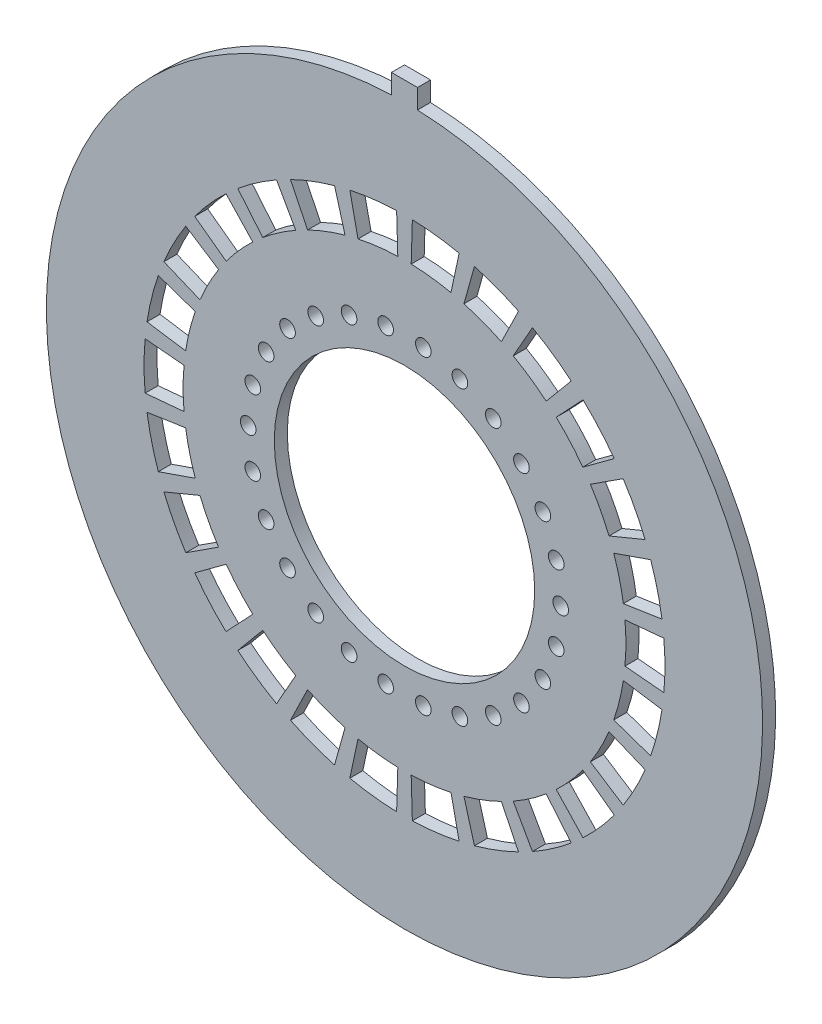
from build123d import *

# Parameters (mm, degrees)
PCB_DIMENSION_R     = 0.6
PCB_DIMENSION_R_2   = 10
BOSS_EXTRUDE1_DEPTH = 1
CUT_EXTRUDE1_DEPTH  = 40.96492758


with BuildPart() as part:
    # PCB dimension → Boss-Extrude1 (new body)
    with BuildSketch(Plane.XY):
        with BuildLine():
            Line((-1, 27.481812167), (-1, 28.981812167))
            Line((-1, 28.981812167), (1, 28.981812167))
            Line((1, 28.981812167), (1, 27.481812167))
            ThreePointArc((1, 27.481812167), (0, -27.5), (-1, 27.481812167))
        make_face()
        with Locations((12, 0)):
            Circle(PCB_DIMENSION_R, mode=Mode.SUBTRACT)
        with Locations((11.651301809, -2.871787971)):
            Circle(PCB_DIMENSION_R, mode=Mode.SUBTRACT)
        with Locations((10.625472308, -5.576678065)):
            Circle(PCB_DIMENSION_R, mode=Mode.SUBTRACT)
        with Locations((8.982128978, -7.957471899)):
            Circle(PCB_DIMENSION_R, mode=Mode.SUBTRACT)
        with Locations((6.816776961, -9.875806391)):
            Circle(PCB_DIMENSION_R, mode=Mode.SUBTRACT)
        with Locations((4.255258645, -11.220194912)):
            Circle(PCB_DIMENSION_R, mode=Mode.SUBTRACT)
        with Locations((1.446440163, -11.912506489)):
            Circle(PCB_DIMENSION_R, mode=Mode.SUBTRACT)
        with Locations((-1.446440163, -11.912506489)):
            Circle(PCB_DIMENSION_R, mode=Mode.SUBTRACT)
        with Locations((-4.255258645, -11.220194912)):
            Circle(PCB_DIMENSION_R, mode=Mode.SUBTRACT)
        with Locations((-6.816776961, -9.875806391)):
            Circle(PCB_DIMENSION_R, mode=Mode.SUBTRACT)
        with Locations((-8.982128978, -7.957471899)):
            Circle(PCB_DIMENSION_R, mode=Mode.SUBTRACT)
        with Locations((-10.625472308, -5.576678065)):
            Circle(PCB_DIMENSION_R, mode=Mode.SUBTRACT)
        with Locations((-11.651301809, -2.871787971)):
            Circle(PCB_DIMENSION_R, mode=Mode.SUBTRACT)
        with Locations((-12, 0)):
            Circle(PCB_DIMENSION_R, mode=Mode.SUBTRACT)
        with Locations((-11.651301809, 2.871787971)):
            Circle(PCB_DIMENSION_R, mode=Mode.SUBTRACT)
        with Locations((-10.625472308, 5.576678065)):
            Circle(PCB_DIMENSION_R, mode=Mode.SUBTRACT)
        with Locations((-8.982128978, 7.957471899)):
            Circle(PCB_DIMENSION_R, mode=Mode.SUBTRACT)
        with Locations((-6.816776961, 9.875806391)):
            Circle(PCB_DIMENSION_R, mode=Mode.SUBTRACT)
        with Locations((-4.255258645, 11.220194912)):
            Circle(PCB_DIMENSION_R, mode=Mode.SUBTRACT)
        with Locations((-1.446440163, 11.912506489)):
            Circle(PCB_DIMENSION_R, mode=Mode.SUBTRACT)
        with Locations((1.446440163, 11.912506489)):
            Circle(PCB_DIMENSION_R, mode=Mode.SUBTRACT)
        with Locations((4.255258645, 11.220194912)):
            Circle(PCB_DIMENSION_R, mode=Mode.SUBTRACT)
        with Locations((6.816776961, 9.875806391)):
            Circle(PCB_DIMENSION_R, mode=Mode.SUBTRACT)
        with Locations((8.982128978, 7.957471899)):
            Circle(PCB_DIMENSION_R, mode=Mode.SUBTRACT)
        with Locations((10.625472308, 5.576678065)):
            Circle(PCB_DIMENSION_R, mode=Mode.SUBTRACT)
        with Locations((11.651301809, 2.871787971)):
            Circle(PCB_DIMENSION_R, mode=Mode.SUBTRACT)
        Circle(PCB_DIMENSION_R_2, mode=Mode.SUBTRACT)
    extrude(amount=BOSS_EXTRUDE1_DEPTH)

    # Sketch1 → Cut-Extrude1 (cut, through all)
    with BuildSketch(Plane.XY.offset(1)):
        with BuildLine():
            Line((16.930241479, 1.538480889), (19.917931152, 1.809977517))
            ThreePointArc((19.917931152, 1.809977517), (20, 0), (19.917931152, -1.809977517))
            Line((19.917931152, -1.809977517), (16.930241479, -1.538480889))
            ThreePointArc((16.930241479, -1.538480889), (17, 0), (16.930241479, 1.538480889))
        make_face()
        with BuildLine():
            Line((18.905996301, -6.524055784), (16.070096856, -5.545447417))
            ThreePointArc((16.070096856, -5.545447417), (16.506010896, -4.068366293), (16.806462008, -2.557896556))
            Line((16.806462008, -2.557896556), (19.772308244, -3.009290065))
            ThreePointArc((19.772308244, -3.009290065), (19.418836349, -4.786313286), (18.905996301, -6.524055784))
        make_face()
        with BuildLine():
            Line((16.795313665, -10.858979644), (14.276016615, -9.230132697))
            ThreePointArc((14.276016615, -9.230132697), (15.052752436, -7.900293925), (15.705952053, -6.50561835))
            Line((15.705952053, -6.50561835), (18.47759065, -7.653668647))
            ThreePointArc((18.47759065, -7.653668647), (17.709120513, -9.294463441), (16.795313665, -10.858979644))
        make_face()
        with BuildLine():
            Line((13.708548447, -14.562819078), (11.65226618, -12.378396216))
            ThreePointArc((11.65226618, -12.378396216), (12.724682719, -11.27308519), (13.692669253, -10.075257253))
            Line((13.692669253, -10.075257253), (16.109022651, -11.853243827))
            ThreePointArc((16.109022651, -11.853243827), (14.970214963, -13.262453165), (13.708548447, -14.562819078))
        make_face()
        with BuildLine():
            Line((9.825092222, -17.4203204), (8.351328388, -14.80727234))
            ThreePointArc((8.351328388, -14.80727234), (9.657100694, -13.99072572), (10.883618288, -13.059358827))
            Line((10.883618288, -13.059358827), (12.804256809, -15.363951561))
            ThreePointArc((12.804256809, -15.363951561), (11.361294935, -16.459677318), (9.825092222, -17.4203204))
        make_face()
        with BuildLine():
            Line((5.370637349, -19.265416021), (4.565041747, -16.375603618))
            ThreePointArc((4.565041747, -16.375603618), (6.02828308, -15.895276126), (7.442050988, -15.284497934))
            Line((7.442050988, -15.284497934), (8.755354103, -17.981762275))
            ThreePointArc((8.755354103, -17.981762275), (7.092097741, -18.700324854), (5.370637349, -19.265416021))
        make_face()
        with BuildLine():
            Line((0.604060556, -19.99087569), (0.513451473, -16.992244336))
            ThreePointArc((0.513451473, -16.992244336), (2.049123564, -16.87605086), (3.567978735, -16.621357578))
            Line((3.567978735, -16.621357578), (4.197622041, -19.554538327))
            ThreePointArc((4.197622041, -19.554538327), (2.410733605, -19.854177482), (0.604060556, -19.99087569))
        make_face()
        with BuildLine():
            Line((-4.197622041, -19.554538327), (-3.567978735, -16.621357578))
            ThreePointArc((-3.567978735, -16.621357578), (-2.049123564, -16.87605086), (-0.513451473, -16.992244336))
            Line((-0.513451473, -16.992244336), (-0.604060556, -19.99087569))
            ThreePointArc((-0.604060556, -19.99087569), (-2.410733605, -19.854177482), (-4.197622041, -19.554538327))
        make_face()
        with BuildLine():
            Line((-8.755354103, -17.981762275), (-7.442050988, -15.284497934))
            ThreePointArc((-7.442050988, -15.284497934), (-6.02828308, -15.895276126), (-4.565041747, -16.375603618))
            Line((-4.565041747, -16.375603618), (-5.370637349, -19.265416021))
            ThreePointArc((-5.370637349, -19.265416021), (-7.092097741, -18.700324854), (-8.755354103, -17.981762275))
        make_face()
        with BuildLine():
            Line((-12.804256809, -15.363951561), (-10.883618288, -13.059358827))
            ThreePointArc((-10.883618288, -13.059358827), (-9.657100694, -13.99072572), (-8.351328388, -14.80727234))
            Line((-8.351328388, -14.80727234), (-9.825092222, -17.4203204))
            ThreePointArc((-9.825092222, -17.4203204), (-11.361294935, -16.459677318), (-12.804256809, -15.363951561))
        make_face()
        with BuildLine():
            Line((-16.109022651, -11.853243827), (-13.692669253, -10.075257253))
            ThreePointArc((-13.692669253, -10.075257253), (-12.724682719, -11.27308519), (-11.65226618, -12.378396216))
            Line((-11.65226618, -12.378396216), (-13.708548447, -14.562819078))
            ThreePointArc((-13.708548447, -14.562819078), (-14.970214963, -13.262453165), (-16.109022651, -11.853243827))
        make_face()
        with BuildLine():
            Line((-18.47759065, -7.653668647), (-15.705952053, -6.50561835))
            ThreePointArc((-15.705952053, -6.50561835), (-15.052752436, -7.900293925), (-14.276016615, -9.230132697))
            Line((-14.276016615, -9.230132697), (-16.795313665, -10.858979644))
            ThreePointArc((-16.795313665, -10.858979644), (-17.709120513, -9.294463441), (-18.47759065, -7.653668647))
        make_face()
        with BuildLine():
            Line((-19.772308244, -3.009290065), (-16.806462008, -2.557896556))
            ThreePointArc((-16.806462008, -2.557896556), (-16.506010896, -4.068366293), (-16.070096856, -5.545447417))
            Line((-16.070096856, -5.545447417), (-18.905996301, -6.524055784))
            ThreePointArc((-18.905996301, -6.524055784), (-19.418836349, -4.786313286), (-19.772308244, -3.009290065))
        make_face()
        with BuildLine():
            Line((-19.917931152, 1.809977517), (-16.930241479, 1.538480889))
            ThreePointArc((-16.930241479, 1.538480889), (-17, 0), (-16.930241479, -1.538480889))
            Line((-16.930241479, -1.538480889), (-19.917931152, -1.809977517))
            ThreePointArc((-19.917931152, -1.809977517), (-20, 0), (-19.917931152, 1.809977517))
        make_face()
        with BuildLine():
            Line((-18.905996301, 6.524055784), (-16.070096856, 5.545447417))
            ThreePointArc((-16.070096856, 5.545447417), (-16.506010896, 4.068366293), (-16.806462008, 2.557896556))
            Line((-16.806462008, 2.557896556), (-19.772308244, 3.009290065))
            ThreePointArc((-19.772308244, 3.009290065), (-19.418836349, 4.786313286), (-18.905996301, 6.524055784))
        make_face()
        with BuildLine():
            Line((-16.795313665, 10.858979644), (-14.276016615, 9.230132697))
            ThreePointArc((-14.276016615, 9.230132697), (-15.052752436, 7.900293925), (-15.705952053, 6.50561835))
            Line((-15.705952053, 6.50561835), (-18.47759065, 7.653668647))
            ThreePointArc((-18.47759065, 7.653668647), (-17.709120513, 9.294463441), (-16.795313665, 10.858979644))
        make_face()
        with BuildLine():
            Line((-13.708548447, 14.562819078), (-11.65226618, 12.378396216))
            ThreePointArc((-11.65226618, 12.378396216), (-12.724682719, 11.27308519), (-13.692669253, 10.075257253))
            Line((-13.692669253, 10.075257253), (-16.109022651, 11.853243827))
            ThreePointArc((-16.109022651, 11.853243827), (-14.970214963, 13.262453165), (-13.708548447, 14.562819078))
        make_face()
        with BuildLine():
            Line((-9.825092222, 17.4203204), (-8.351328388, 14.80727234))
            ThreePointArc((-8.351328388, 14.80727234), (-9.657100694, 13.99072572), (-10.883618288, 13.059358827))
            Line((-10.883618288, 13.059358827), (-12.804256809, 15.363951561))
            ThreePointArc((-12.804256809, 15.363951561), (-11.361294935, 16.459677318), (-9.825092222, 17.4203204))
        make_face()
        with BuildLine():
            Line((-5.370637349, 19.265416021), (-4.565041747, 16.375603618))
            ThreePointArc((-4.565041747, 16.375603618), (-6.02828308, 15.895276126), (-7.442050988, 15.284497934))
            Line((-7.442050988, 15.284497934), (-8.755354103, 17.981762275))
            ThreePointArc((-8.755354103, 17.981762275), (-7.092097741, 18.700324854), (-5.370637349, 19.265416021))
        make_face()
        with BuildLine():
            Line((-0.604060556, 19.99087569), (-0.513451473, 16.992244336))
            ThreePointArc((-0.513451473, 16.992244336), (-2.049123564, 16.87605086), (-3.567978735, 16.621357578))
            Line((-3.567978735, 16.621357578), (-4.197622041, 19.554538327))
            ThreePointArc((-4.197622041, 19.554538327), (-2.410733605, 19.854177482), (-0.604060556, 19.99087569))
        make_face()
        with BuildLine():
            Line((4.197622041, 19.554538327), (3.567978735, 16.621357578))
            ThreePointArc((3.567978735, 16.621357578), (2.049123564, 16.87605086), (0.513451473, 16.992244336))
            Line((0.513451473, 16.992244336), (0.604060556, 19.99087569))
            ThreePointArc((0.604060556, 19.99087569), (2.410733605, 19.854177482), (4.197622041, 19.554538327))
        make_face()
        with BuildLine():
            Line((8.755354103, 17.981762275), (7.442050988, 15.284497934))
            ThreePointArc((7.442050988, 15.284497934), (6.02828308, 15.895276126), (4.565041747, 16.375603618))
            Line((4.565041747, 16.375603618), (5.370637349, 19.265416021))
            ThreePointArc((5.370637349, 19.265416021), (7.092097741, 18.700324854), (8.755354103, 17.981762275))
        make_face()
        with BuildLine():
            Line((12.804256809, 15.363951561), (10.883618288, 13.059358827))
            ThreePointArc((10.883618288, 13.059358827), (9.657100694, 13.99072572), (8.351328388, 14.80727234))
            Line((8.351328388, 14.80727234), (9.825092222, 17.4203204))
            ThreePointArc((9.825092222, 17.4203204), (11.361294935, 16.459677318), (12.804256809, 15.363951561))
        make_face()
        with BuildLine():
            Line((16.109022651, 11.853243827), (13.692669253, 10.075257253))
            ThreePointArc((13.692669253, 10.075257253), (12.724682719, 11.27308519), (11.65226618, 12.378396216))
            Line((11.65226618, 12.378396216), (13.708548447, 14.562819078))
            ThreePointArc((13.708548447, 14.562819078), (14.970214963, 13.262453165), (16.109022651, 11.853243827))
        make_face()
        with BuildLine():
            Line((18.47759065, 7.653668647), (15.705952053, 6.50561835))
            ThreePointArc((15.705952053, 6.50561835), (15.052752436, 7.900293925), (14.276016615, 9.230132697))
            Line((14.276016615, 9.230132697), (16.795313665, 10.858979644))
            ThreePointArc((16.795313665, 10.858979644), (17.709120513, 9.294463441), (18.47759065, 7.653668647))
        make_face()
        with BuildLine():
            Line((19.772308244, 3.009290065), (16.806462008, 2.557896556))
            ThreePointArc((16.806462008, 2.557896556), (16.506010896, 4.068366293), (16.070096856, 5.545447417))
            Line((16.070096856, 5.545447417), (18.905996301, 6.524055784))
            ThreePointArc((18.905996301, 6.524055784), (19.418836349, 4.786313286), (19.772308244, 3.009290065))
        make_face()
    extrude(amount=-CUT_EXTRUDE1_DEPTH, mode=Mode.SUBTRACT)


solid = part.part
